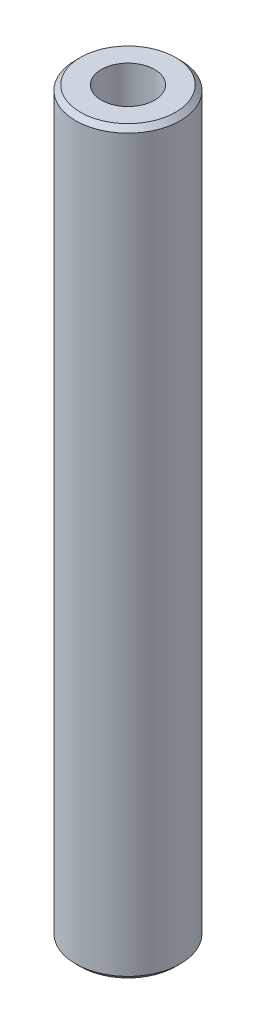
from build123d import *

# Parameters (mm, degrees)
SKETCH1_R           = 42.5
BOSS_EXTRUDE1_DEPTH = 600
SKETCH2_R           = 21.597051063
CUT_EXTRUDE1_DEPTH  = 604.002902149
CHAMFER1_SIZE       = 3.931764299


with BuildPart() as part:
    # Sketch1 → Boss-Extrude1 (new body)
    with BuildSketch(Plane(origin=(0, 0, 0), x_dir=(1, 0, 0), z_dir=(0, 1, 0))):
        Circle(SKETCH1_R)
    extrude(amount=BOSS_EXTRUDE1_DEPTH)

    # Sketch2 → Cut-Extrude1 (cut, through all)
    with BuildSketch(Plane(origin=(0, 0, 0), x_dir=(1, 0, 0), z_dir=(0, 1, 0))):
        Circle(SKETCH2_R)
    extrude(amount=CUT_EXTRUDE1_DEPTH, mode=Mode.SUBTRACT)

    # Chamfer1
    chamfer1_edges = [part.edges().sort_by_distance(p)[0] for p in [
        (-42.5, 600, 0),
        (-42.5, 0, 0),
    ]]
    chamfer(chamfer1_edges, length=CHAMFER1_SIZE)


solid = part.part
